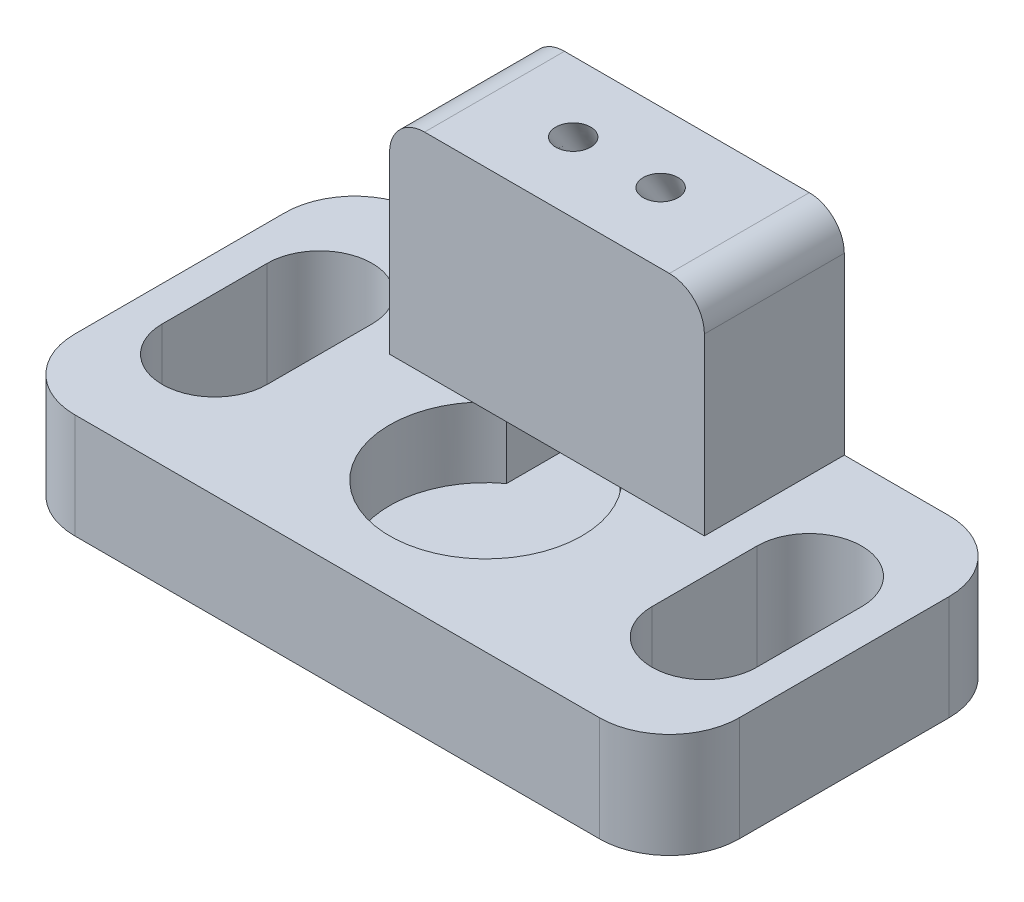
from build123d import *

# Parameters (mm, degrees)
SKETCH1_W            = 9
SKETCH1_H            = 9
BOSS_EXTRUDE1_DEPTH  = 8
SKETCH3_W            = 9
SKETCH3_H            = 9
BOSS_EXTRUDE2_DEPTH  = 2
SKETCH5_W            = 5
SKETCH5_H            = 10
BOSS_EXTRUDE3_DEPTH  = 3
FILLET1_R            = 2
FILLET1_OF_MIRROR2_R = 2
FILLET2_R            = 1
SKETCH6_W            = 3.25
SKETCH6_H            = 2
CUT_EXTRUDE1_DEPTH   = 5.75
SKETCH7_W            = 6
SKETCH7_H            = 6
CUT_EXTRUDE2_DEPTH   = 17.740669043
SKETCH8_R            = 2.75
CUT_EXTRUDE3_DEPTH   = 2


with BuildPart() as part:
    # Sketch1 → Boss-Extrude1 (new body)
    with BuildSketch(Plane.XY):
        Rectangle(SKETCH1_W, SKETCH1_H)
    extrude(amount=BOSS_EXTRUDE1_DEPTH)

    # Sketch3 → Boss-Extrude2 (add)
    with BuildSketch(Plane(origin=(0, 0, 0), x_dir=(-1, 0, 0), z_dir=(0, 0, -1))):
        Rectangle(SKETCH3_W, SKETCH3_H)
    extrude(amount=BOSS_EXTRUDE2_DEPTH)

    # Sketch5 → Boss-Extrude3 (add)
    with BuildSketch(Plane.XZ.offset(4.5)):
        with Locations((7, 3)):
            Rectangle(SKETCH5_W, SKETCH5_H)
        with BuildLine():
            Line((8.5, 4.5), (8.5, 1.5))
            ThreePointArc((8.5, 1.5), (7, 0), (5.5, 1.5))
            Line((5.5, 1.5), (5.5, 4.5))
            ThreePointArc((5.5, 4.5), (7, 6), (8.5, 4.5))
        make_face(mode=Mode.SUBTRACT)
    boss_extrude3 = extrude(amount=-BOSS_EXTRUDE3_DEPTH)

    # Fillet1
    fillet1_edges = [part.edges().sort_by_distance(p)[0] for p in [
        (9.5, -3, -2),
        (9.5, -3, 8),
    ]]
    fillet(fillet1_edges, radius=FILLET1_R)

    # Mirror2: Boss-Extrude3 across plane
    add(boss_extrude3.mirror(Plane(origin=(0, 0, 0), x_dir=(0, 0, 1), z_dir=(1, 0, 0))))

    # Fillet1 of Mirror2
    fillet1_of_mirror2_edges = [part.edges().sort_by_distance(p)[0] for p in [
        (-9.5, -3, -2),
        (-9.5, -3, 8),
    ]]
    fillet(fillet1_of_mirror2_edges, radius=FILLET1_OF_MIRROR2_R)

    # Fillet2
    fillet2_edges = [part.edges().sort_by_distance(p)[0] for p in [
        (4.5, 4.5, 3),
        (-4.5, 4.5, 3),
    ]]
    fillet(fillet2_edges, radius=FILLET2_R)

    # Sketch6 → Cut-Extrude1 (cut)
    with BuildSketch(Plane(origin=(0, 0, -2), x_dir=(-1, 0, 0), z_dir=(0, 0, -1))):
        with Locations((0, -2.5)):
            Rectangle(SKETCH6_W, SKETCH6_H)
    extrude(amount=-CUT_EXTRUDE1_DEPTH, mode=Mode.SUBTRACT)

    # Sketch7 → Cut-Extrude2 (cut, through all)
    with BuildSketch(Plane(origin=(4.5, 0, 0), x_dir=(0, 0, -1), z_dir=(1, 0, 0))):
        with Locations((-5, 1.5)):
            Rectangle(SKETCH7_W, SKETCH7_H)
    extrude(amount=-CUT_EXTRUDE2_DEPTH, mode=Mode.SUBTRACT)

    # Sketch8 → Cut-Extrude3 (cut)
    with BuildSketch(Plane(origin=(0, -1.5, 0), x_dir=(1, 0, 0), z_dir=(0, 1, 0))):
        with Locations((0, -3.75)):
            Circle(SKETCH8_R)
    extrude(amount=-CUT_EXTRUDE3_DEPTH, mode=Mode.SUBTRACT)

    # Cut-Loft1: read off the stored shape, not the designer's step
    # Cut-Loft1: loft between two sections, ruled curve by curve
    cut_loft1_from = [
        Edge.make_bspline([(1.618331944, 4.5, 0.33812953), (1.590154483, 4.5, 0.368823859), (1.554547709, 4.5, 0.400118904), (1.463297086, 4.5, 0.455355682), (1.407321542, 4.5, 0.479264412), (1.276254131, 4.5, 0.503741169), (1.200923259, 4.5, 0.503729048), (1.049042928, 4.5, 0.464508058), (0.973259127, 4.5, 0.424686865), (0.850481812, 4.5, 0.311977022), (0.804337969, 4.5, 0.23986837), (0.752297501, 4.5, 0.09188962), (0.745856132, 4.5, 0.016834645), (0.759057321, 4.5, -0.115843561), (0.778101449, 4.5, -0.173655412), (0.825348682, 4.5, -0.269287398), (0.853490596, 4.5, -0.307435202), (0.909845517, 4.5, -0.368823859), (0.945452291, 4.5, -0.400118904), (1.036702914, 4.5, -0.455355682), (1.092678458, 4.5, -0.479264412), (1.223745869, 4.5, -0.503741169), (1.299076741, 4.5, -0.503729048), (1.450957072, 4.5, -0.464508058), (1.526740873, 4.5, -0.424686865), (1.649518188, 4.5, -0.311977022), (1.695662031, 4.5, -0.23986837), (1.747702499, 4.5, -0.09188962), (1.754143868, 4.5, -0.016834645), (1.740942679, 4.5, 0.115843561), (1.721898551, 4.5, 0.173655412), (1.674651318, 4.5, 0.269287398), (1.646509404, 4.5, 0.307435202), (1.618331944, 4.5, 0.33812953)], [0, 0, 0, 0, 0.0625, 0.0625, 0.125, 0.125, 0.1875, 0.1875, 0.25, 0.25, 0.3125, 0.3125, 0.375, 0.375, 0.4375, 0.4375, 0.5, 0.5, 0.5625, 0.5625, 0.625, 0.625, 0.6875, 0.6875, 0.75, 0.75, 0.8125, 0.8125, 0.875, 0.875, 0.9375, 0.9375, 1, 1, 1, 1], 3),
    ]
    cut_loft1_to = [
        Edge.make_bspline([(1.243402847, 1.499956476, -2), (1.285065886, 1.500506238, -2), (1.332261968, 1.496061904, -2), (1.435047124, 1.467548935, -2), (1.4908397, 1.443216294, -2), (1.598552626, 1.364630651, -2), (1.650214755, 1.309805794, -2), (1.725852293, 1.172383512, -2), (1.74885695, 1.089923232, -2), (1.751056001, 0.923271074, -2), (1.730235177, 0.840232497, -2), (1.658250042, 0.700862267, -2), (1.608052526, 0.644693326, -2), (1.502450689, 0.563292897, -2), (1.447319588, 0.537496568, -2), (1.345322572, 0.506281404, -2), (1.298260193, 0.500593287, -2), (1.214934114, 0.499493762, -2), (1.167738032, 0.503938096, -2), (1.064952876, 0.532451065, -2), (1.0091603, 0.556783706, -2), (0.901447374, 0.635369349, -2), (0.849785245, 0.690194206, -2), (0.774147707, 0.827616488, -2), (0.75114305, 0.910076768, -2), (0.748943999, 1.076728926, -2), (0.769764823, 1.159767503, -2), (0.841749958, 1.299137733, -2), (0.891947474, 1.355306674, -2), (0.997549311, 1.436707103, -2), (1.052680412, 1.462503432, -2), (1.154677428, 1.493718596, -2), (1.201739807, 1.499406713, -2), (1.243402847, 1.499956476, -2)], [0, 0, 0, 0, 0.0625, 0.0625, 0.125, 0.125, 0.1875, 0.1875, 0.25, 0.25, 0.3125, 0.3125, 0.375, 0.375, 0.4375, 0.4375, 0.5, 0.5, 0.5625, 0.5625, 0.625, 0.625, 0.6875, 0.6875, 0.75, 0.75, 0.8125, 0.8125, 0.875, 0.875, 0.9375, 0.9375, 1, 1, 1, 1], 3),
    ]
    cut_loft1 = Solid(Shell([*[Face.make_surface_from_curves(cut_loft1_from[k], cut_loft1_to[k]) for k in range(1)], Face(Wire(cut_loft1_from)), Face(Wire(cut_loft1_to))]))
    add(cut_loft1, mode=Mode.SUBTRACT)

    # Cut-Loft2: read off the stored shape, not the designer's step
    # Cut-Loft2: loft between two sections, ruled curve by curve
    cut_loft2_from = [
        Edge.make_bspline([(-0.779241198, 4.5, -0.168481901), (-0.76520104, 4.5, -0.129252), (-0.754089169, 4.5, -0.083167854), (-0.747704068, 4.5, 0.023307534), (-0.752614517, 4.5, 0.083976936), (-0.79199312, 4.5, 0.211362585), (-0.827085975, 4.5, 0.278020157), (-0.932525917, 4.5, 0.394159468), (-1.003058299, 4.5, 0.442678485), (-1.1599779, 4.5, 0.498839118), (-1.245279169, 4.5, 0.506092081), (-1.400466938, 4.5, 0.483229946), (-1.469885794, 4.5, 0.453976521), (-1.581150008, 4.5, 0.380505081), (-1.623440974, 4.5, 0.336728797), (-1.68606606, 4.5, 0.25038138), (-1.706718643, 4.5, 0.207711801), (-1.73479896, 4.5, 0.129252), (-1.745910831, 4.5, 0.083167854), (-1.752295932, 4.5, -0.023307534), (-1.747385483, 4.5, -0.083976936), (-1.70800688, 4.5, -0.211362585), (-1.672914025, 4.5, -0.278020157), (-1.567474083, 4.5, -0.394159468), (-1.496941701, 4.5, -0.442678485), (-1.3400221, 4.5, -0.498839118), (-1.254720831, 4.5, -0.506092081), (-1.099533062, 4.5, -0.483229946), (-1.030114206, 4.5, -0.453976521), (-0.918849992, 4.5, -0.380505081), (-0.876559026, 4.5, -0.336728797), (-0.81393394, 4.5, -0.25038138), (-0.793281357, 4.5, -0.207711801), (-0.779241198, 4.5, -0.168481901)], [0, 0, 0, 0, 0.0625, 0.0625, 0.125, 0.125, 0.1875, 0.1875, 0.25, 0.25, 0.3125, 0.3125, 0.375, 0.375, 0.4375, 0.4375, 0.5, 0.5, 0.5625, 0.5625, 0.625, 0.625, 0.6875, 0.6875, 0.75, 0.75, 0.8125, 0.8125, 0.875, 0.875, 0.9375, 0.9375, 1, 1, 1, 1], 3),
    ]
    cut_loft2_to = [
        Edge.make_bspline([(-1.19856901, 1.497347819, -2), (-1.157123358, 1.493061903, -2), (-1.110761205, 1.483173884, -2), (-1.011976516, 1.442932574, -2), (-0.959382471, 1.412293459, -2), (-0.861510562, 1.321745864, -2), (-0.816555497, 1.261299336, -2), (-0.757366243, 1.116032158, -2), (-0.744080349, 1.031460313, -2), (-0.761224012, 0.865677707, -2), (-0.791534928, 0.78561423, -2), (-0.879198087, 0.655533134, -2), (-0.935571187, 0.605565004, -2), (-1.049901014, 0.536961297, -2), (-1.107651872, 0.517733005, -2), (-1.21258085, 0.498557828, -2), (-1.259985338, 0.498366265, -2), (-1.342876642, 0.506938097, -2), (-1.389238795, 0.516826116, -2), (-1.488023484, 0.557067426, -2), (-1.540617529, 0.587706541, -2), (-1.638489438, 0.678254136, -2), (-1.683444503, 0.738700664, -2), (-1.742633757, 0.883967842, -2), (-1.755919651, 0.968539687, -2), (-1.738775988, 1.134322293, -2), (-1.708465072, 1.21438577, -2), (-1.620801913, 1.344466866, -2), (-1.564428813, 1.394434996, -2), (-1.450098986, 1.463038703, -2), (-1.392348128, 1.482266995, -2), (-1.28741915, 1.501442172, -2), (-1.240014662, 1.501633735, -2), (-1.19856901, 1.497347819, -2)], [0, 0, 0, 0, 0.0625, 0.0625, 0.125, 0.125, 0.1875, 0.1875, 0.25, 0.25, 0.3125, 0.3125, 0.375, 0.375, 0.4375, 0.4375, 0.5, 0.5, 0.5625, 0.5625, 0.625, 0.625, 0.6875, 0.6875, 0.75, 0.75, 0.8125, 0.8125, 0.875, 0.875, 0.9375, 0.9375, 1, 1, 1, 1], 3),
    ]
    cut_loft2 = Solid(Shell([*[Face.make_surface_from_curves(cut_loft2_from[k], cut_loft2_to[k]) for k in range(1)], Face(Wire(cut_loft2_from)), Face(Wire(cut_loft2_to))]))
    add(cut_loft2, mode=Mode.SUBTRACT)


solid = part.part
